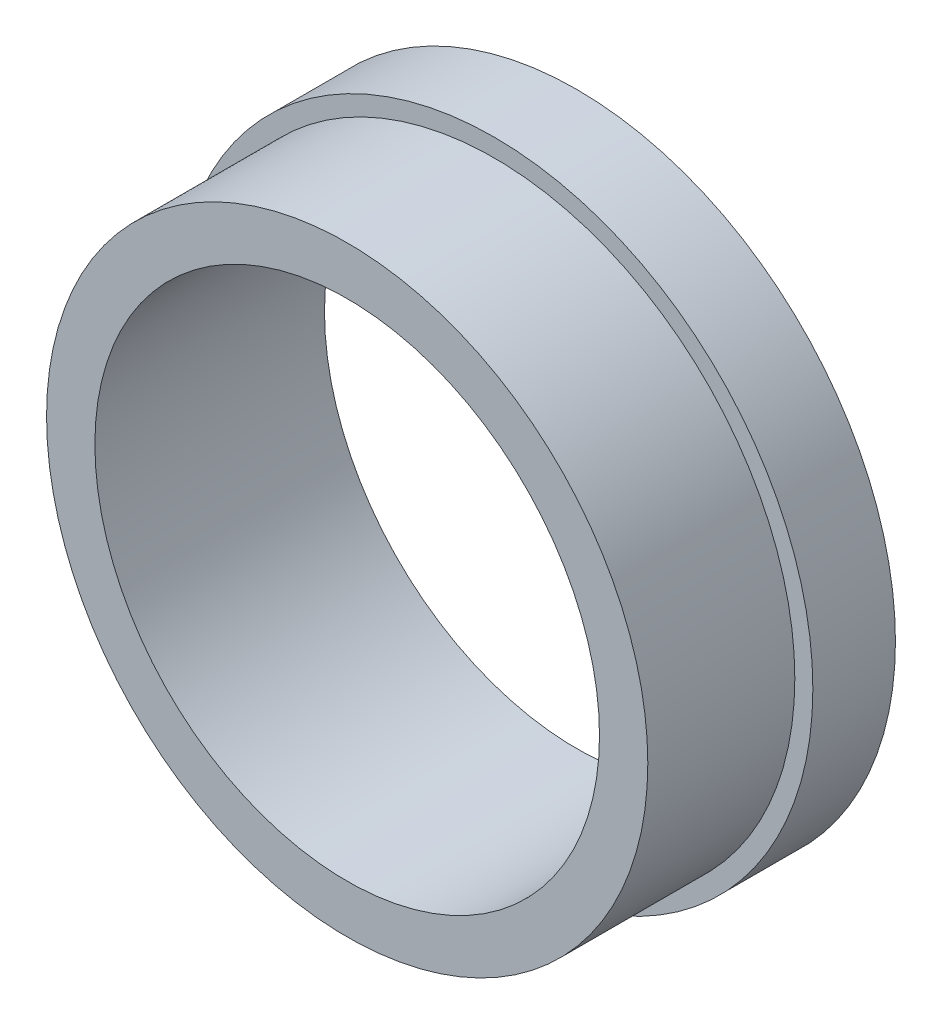
from build123d import *

# Parameters (mm, degrees)
SKETCH1_R         = 49
SKETCH1_R_2       = 38.7985
EXTRUDE1_DEPTH    = 35.306
SKETCH2_OUTSIDE_W = 128.604
SKETCH2_OUTSIDE_H = 128.604
SKETCH2_OUTSIDE_R = 46.228
EXTRUDE2_DEPTH    = 22.606


with BuildPart() as part:
    # Sketch1 → Extrude1 (new body)
    with BuildSketch(Plane.XY):
        Circle(SKETCH1_R)
        Circle(SKETCH1_R_2, mode=Mode.SUBTRACT)
    extrude(amount=EXTRUDE1_DEPTH)

    # Sketch2 outside → Extrude2 (cut)
    with BuildSketch(Plane.XY.offset(35.306)):
        Rectangle(SKETCH2_OUTSIDE_W, SKETCH2_OUTSIDE_H)
        Circle(SKETCH2_OUTSIDE_R, mode=Mode.SUBTRACT)
    extrude(amount=-EXTRUDE2_DEPTH, mode=Mode.SUBTRACT)


solid = part.part
